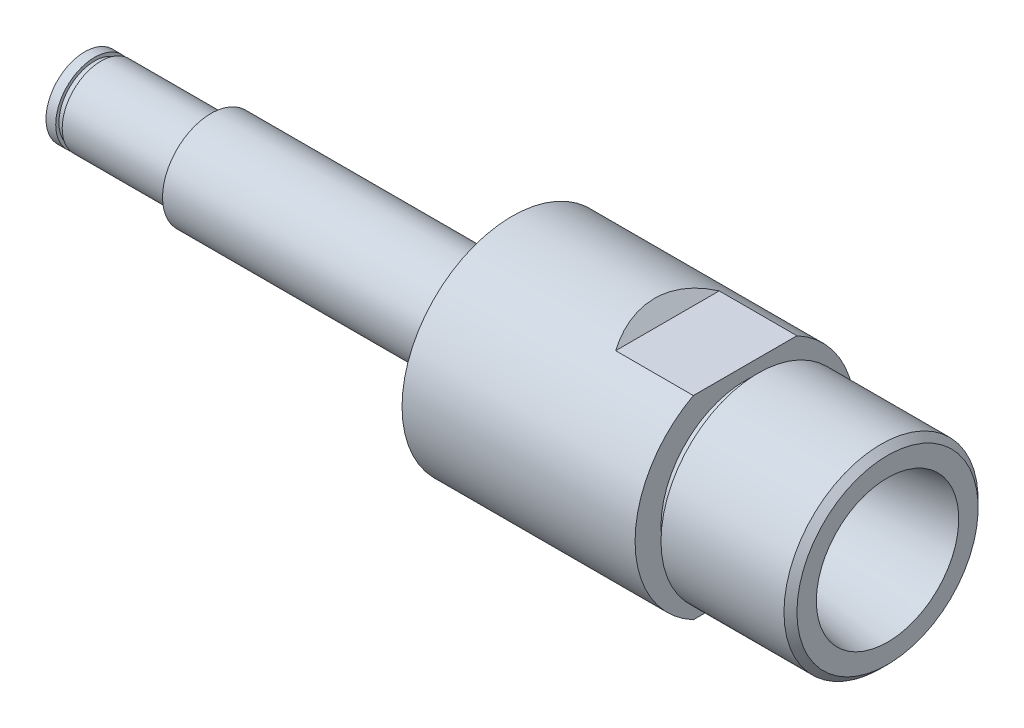
from build123d import *

# Parameters (mm, degrees)
SKETCH_4_OUTSIDE_W  = 62.6
SKETCH_4_OUTSIDE_H  = 62.6
CUT_EXTRUDE_2_DEPTH = 14
CHAMFER_1_SIZE      = 2
CHAMFER_2_SIZE      = 1


with BuildPart() as part:
    # 草图1 → 旋转1 (revolve)
    with BuildSketch(Plane.XY, mode=Mode.PRIVATE) as revolve_1_sk:
        Polygon((0, 6.5), (0, 17), (36, 17), (36, 13), (38, 13), (38, 15), (58, 15), (58, 11), (42, 8.680110408), (42, 9.5), (37, 9.5), (37, 9), (31, 9), (31, 9.5), (26, 9.5), (26, 7), (10, 7), (5.793975667, 0), (-66, 0), (-66, 6), (-64.5, 6), (-64.5, 5.5), (-63.5, 5.5), (-63.5, 6), (-47.5, 6), (-47.5, 5.5), (-46.5, 5.5), (-46.5, 7.5), (-2, 7.5), (-2, 6.5), align=None)
    revolve(revolve_1_sk.sketch.rotate(Axis((-14.714771185, 0, 0), (1, 0, 0)), 90), axis=Axis((-14.714771185, 0, 0), (1, 0, 0)))

    # 草图4 outside → 切除-拉伸2 (cut)
    with BuildSketch(Plane(origin=(36, 0, 0), x_dir=(0, 0, -1), z_dir=(1, 0, 0))):
        Rectangle(SKETCH_4_OUTSIDE_W, SKETCH_4_OUTSIDE_H)
        with BuildLine():
            Line((-8, -15), (8, -15))
            ThreePointArc((8, -15), (17, 0), (8, 15))
            Line((8, 15), (-8, 15))
            ThreePointArc((-8, 15), (-17, 0), (-8, -15))
        make_face(mode=Mode.SUBTRACT)
    extrude(amount=-CUT_EXTRUDE_2_DEPTH, mode=Mode.SUBTRACT)

    # 倒角1
    chamfer_1_edges = [part.edges().sort_by_distance(p)[0] for p in [
        (22, -15, 0),
        (22, 15, 0),
    ]]
    chamfer(chamfer_1_edges, length=CHAMFER_1_SIZE - 0.0001)  # a hair under: the kernel refuses the full size

    # 倒角2
    chamfer_2_edges = [part.edges().sort_by_distance(p)[0] for p in [
        (58, 0, -15),
    ]]
    chamfer(chamfer_2_edges, length=CHAMFER_2_SIZE)


solid = part.part
